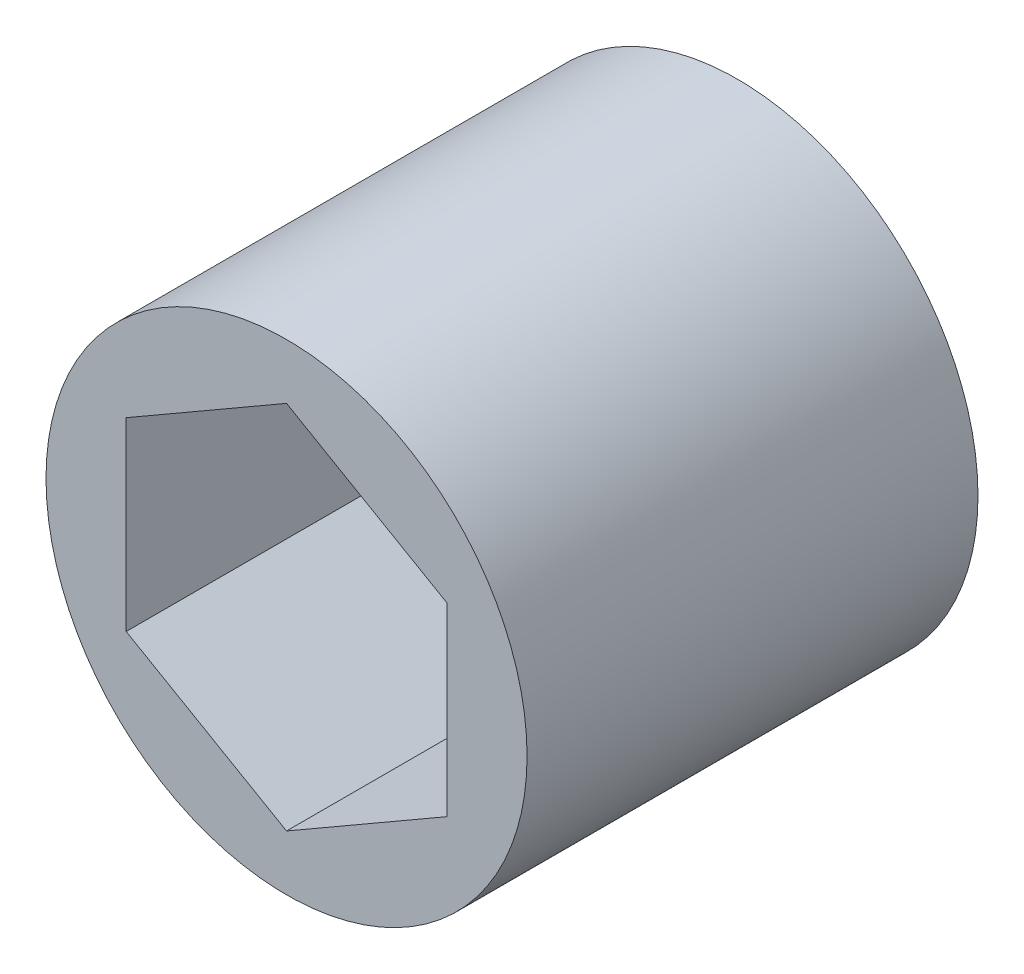
from build123d import *

# Parameters (mm, degrees)
SKETCH1_R           = 9.525
BOSS_EXTRUDE1_DEPTH = 8.9281


with BuildPart() as part:
    # Sketch1 → Boss-Extrude1 (new, symmetric)
    with BuildSketch(Plane.XY):
        Circle(SKETCH1_R)
        Polygon((0, 7.332348419), (-6.35, 3.666174209), (-6.35, -3.666174209), (0, -7.332348419), (6.35, -3.666174209), (6.35, 3.666174209), align=None, mode=Mode.SUBTRACT)
    extrude(amount=BOSS_EXTRUDE1_DEPTH, both=True)


solid = part.part
